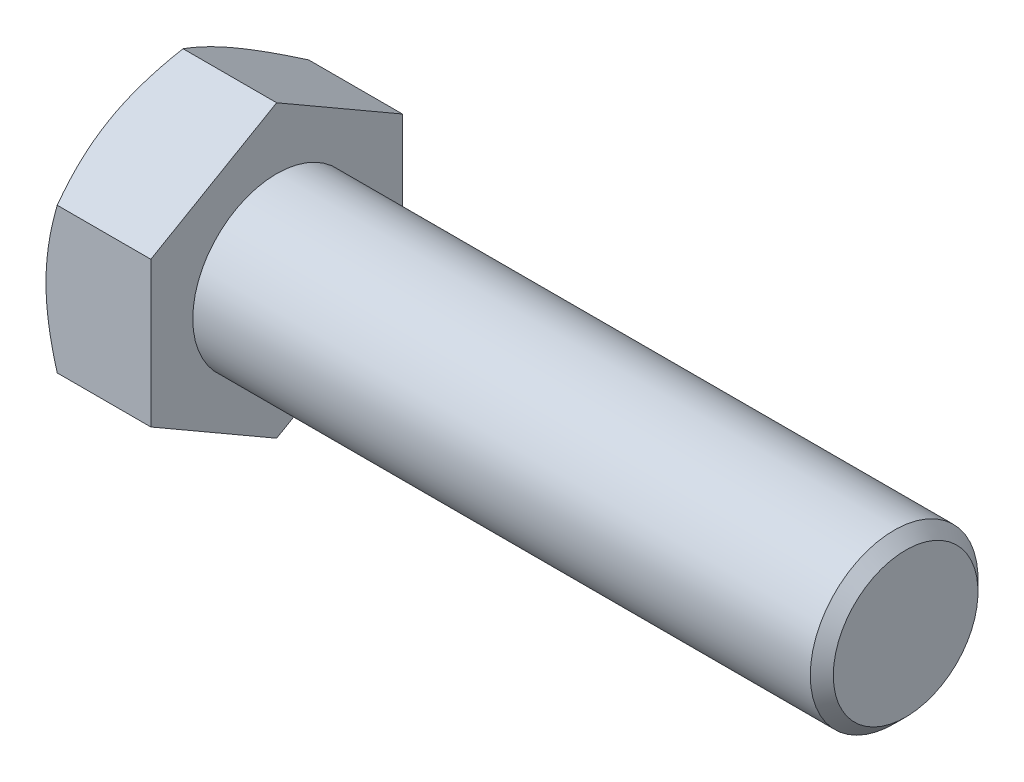
from build123d import *

# Parameters (mm, degrees)
BASEHEAD_DEPTH = 15


with BuildPart() as part:
    # BaseHeadSke → BaseHead (new body)
    with BuildSketch(Plane(origin=(0, 0, 0), x_dir=(0, 0, -1), z_dir=(1, 0, 0))):
        Polygon((0, 20.784609691), (-18, 10.392304845), (-18, -10.392304845), (0, -20.784609691), (18, -10.392304845), (18, 10.392304845), align=None)
    extrude(amount=BASEHEAD_DEPTH)

    # HeadChamferSke → HeadChamfer (revolve, cut)
    with BuildSketch(Plane.XY):
        Polygon((0, 20.784609691), (0, 18), (1.607695155, 20.784609691), align=None)
    revolve(axis=Axis((0, 0, 0), (1, 0, 0)), mode=Mode.SUBTRACT)

    # BodySke → BaseBody (revolve)
    with BuildSketch(Plane.XY):
        Polygon((0, 0), (0, 12), (103.352, 12), (105, 10.352), (105, 0), align=None)
    revolve(axis=Axis((0, 0, 0), (1, 0, 0)))


solid = part.part
